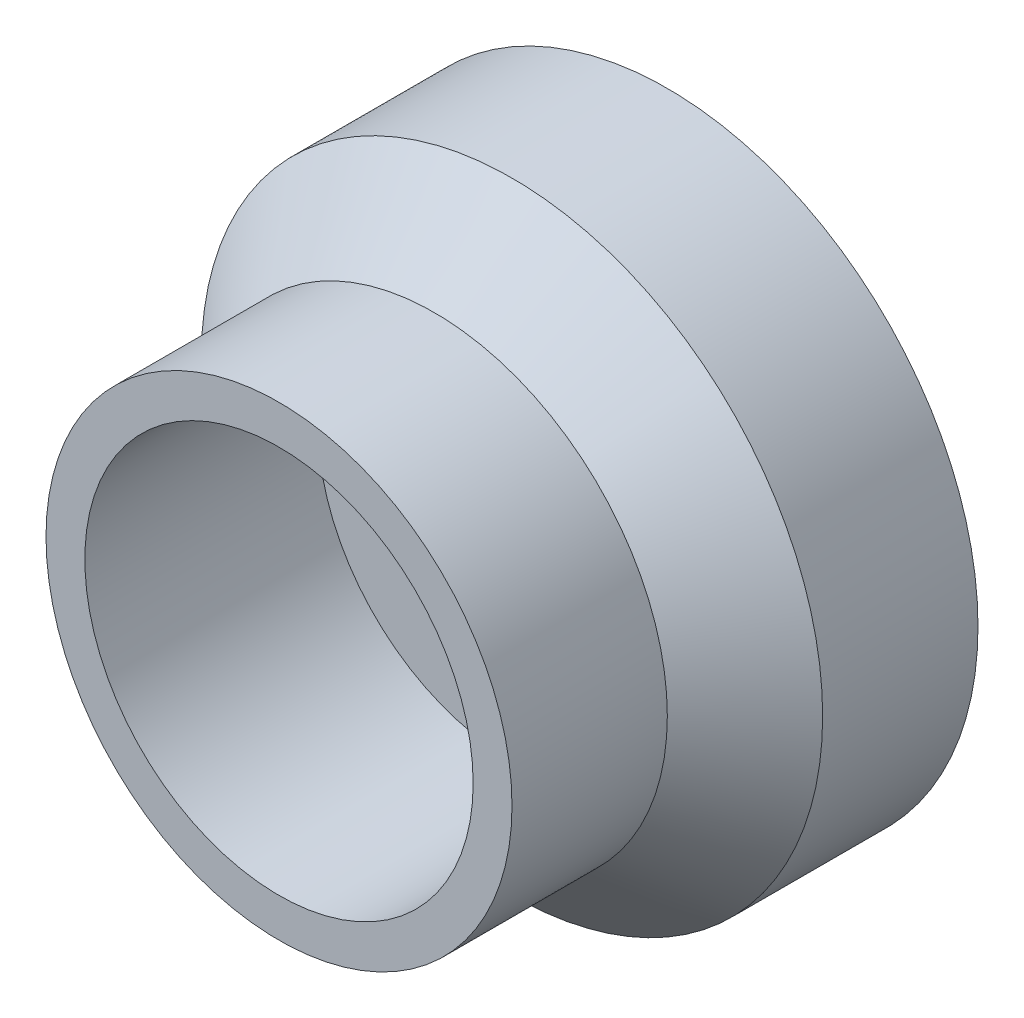
from build123d import *

# Parameters (mm, degrees)
SKETCH1_R           = 15
SKETCH1_R_2         = 12.5
BOSS_EXTRUDE1_DEPTH = 15
BOSS_EXTRUDE2_START = -10
SKETCH1_3_R         = 20
SKETCH1_3_R_2       = 15
SKETCH1_3_R_3       = 12.5
BOSS_EXTRUDE2_DEPTH = 10
CHAMFER1_SIZE       = 5


with BuildPart() as part:
    # Sketch1 → Boss-Extrude1 (new body)
    with BuildSketch(Plane.XY):
        Circle(SKETCH1_R)
        Circle(SKETCH1_R_2, mode=Mode.SUBTRACT)
    extrude(amount=BOSS_EXTRUDE1_DEPTH)

    # Sketch1<3> → Boss-Extrude2 (add)
    # profile 1 of 3: a face of its own
    with BuildSketch(Plane.XY.offset(BOSS_EXTRUDE2_START)):
        Circle(SKETCH1_3_R)
        Circle(SKETCH1_3_R_2, mode=Mode.SUBTRACT)
    # profile 2 of 3: a face of its own
    with BuildSketch(Plane.XY.offset(BOSS_EXTRUDE2_START)):
        Circle(SKETCH1_3_R_2)
        Circle(SKETCH1_3_R_3, mode=Mode.SUBTRACT)
    # profile 3 of 3: a face of its own
    with BuildSketch(Plane.XY.offset(BOSS_EXTRUDE2_START)):
        Circle(SKETCH1_3_R_3)
    extrude(amount=BOSS_EXTRUDE2_DEPTH)

    # Chamfer1
    chamfer1_edges = [part.edges().sort_by_distance(p)[0] for p in [
        (-15, 0, 0),
    ]]
    chamfer(chamfer1_edges, length=CHAMFER1_SIZE - 0.0001)  # a hair under: the kernel refuses the full size


solid = part.part
